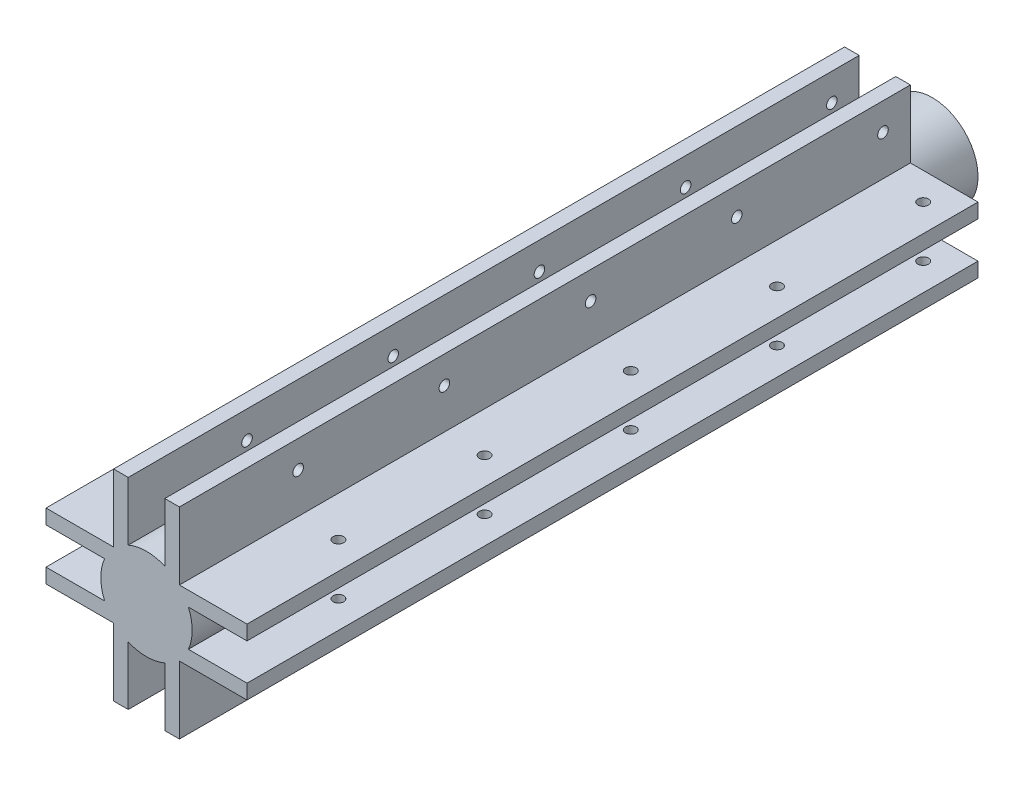
from build123d import *
from build123d.topology import SkipClean

# Parameters (mm, degrees)
SKETCH1_R           = 12.5
BOSS_EXTRUDE1_DEPTH = 100
SKETCH4_W           = 4
SKETCH4_H           = 27.5
BOSS_EXTRUDE3_DEPTH = 200
CIRPATTERN7_COUNT   = 4
SKETCH7_R           = 1.45
CUT_EXTRUDE2_DEPTH  = 27
CIRPATTERN9_COUNT   = 4
SKETCH10_R          = 12.5
BOSS_EXTRUDE4_DEPTH = 15


with BuildPart() as part:
    # Sketch1 → Boss-Extrude1 (new, symmetric)
    with BuildSketch(Plane.XY):
        Circle(SKETCH1_R)
    extrude(amount=BOSS_EXTRUDE1_DEPTH, both=True)

    # Sketch4 → Boss-Extrude3 (add)
    with BuildSketch(Plane.XY.offset(100)):
        with Locations((-7, 13.75)):
            Rectangle(SKETCH4_W, SKETCH4_H)
        with Locations((7, 13.75)):
            Rectangle(SKETCH4_W, SKETCH4_H)
    boss_extrude3 = extrude(amount=-BOSS_EXTRUDE3_DEPTH)

    # CirPattern7: Boss-Extrude3 ×4 about axis
    cirpattern7_axis = Axis((0, 0, 0), (0, 0, 1))
    for i in range(1, CIRPATTERN7_COUNT):
        add(boss_extrude3.rotate(cirpattern7_axis, i * 360 / CIRPATTERN7_COUNT))

    # Sketch7 → Cut-Extrude2 (cut)
    with BuildSketch(Plane.ZY.offset(9)):
        with Locations((-92.5, 20)):
            Circle(SKETCH7_R)
        with Locations((-52.5, 20)):
            Circle(SKETCH7_R)
        with Locations((-12.5, 20)):
            Circle(SKETCH7_R)
        with Locations((27.5, 20)):
            Circle(SKETCH7_R)
        with Locations((67.5, 20)):
            Circle(SKETCH7_R)
    cut_extrude2 = extrude(amount=-CUT_EXTRUDE2_DEPTH, mode=Mode.SUBTRACT)

    # CirPattern9: Cut-Extrude2 ×4 about axis
    cirpattern9_axis = Axis((0, 0, 100), (0, 0, 1))
    for i in range(1, CIRPATTERN9_COUNT):
        add(cut_extrude2.rotate(cirpattern9_axis, i * 360 / CIRPATTERN9_COUNT), mode=Mode.SUBTRACT)

    # Sketch10 → Boss-Extrude4 (add)
    with SkipClean():  # the faces are left unmerged after this step: merging them gives an invalid solid
        with BuildSketch(Plane(origin=(0, 0, -100), x_dir=(-1, 0, 0), z_dir=(0, 0, -1))):
            Circle(SKETCH10_R)
        extrude(amount=BOSS_EXTRUDE4_DEPTH)
    add(part.part.scale(1), mode=Mode.REPLACE)  # the faces are merged on a copy


solid = part.part
